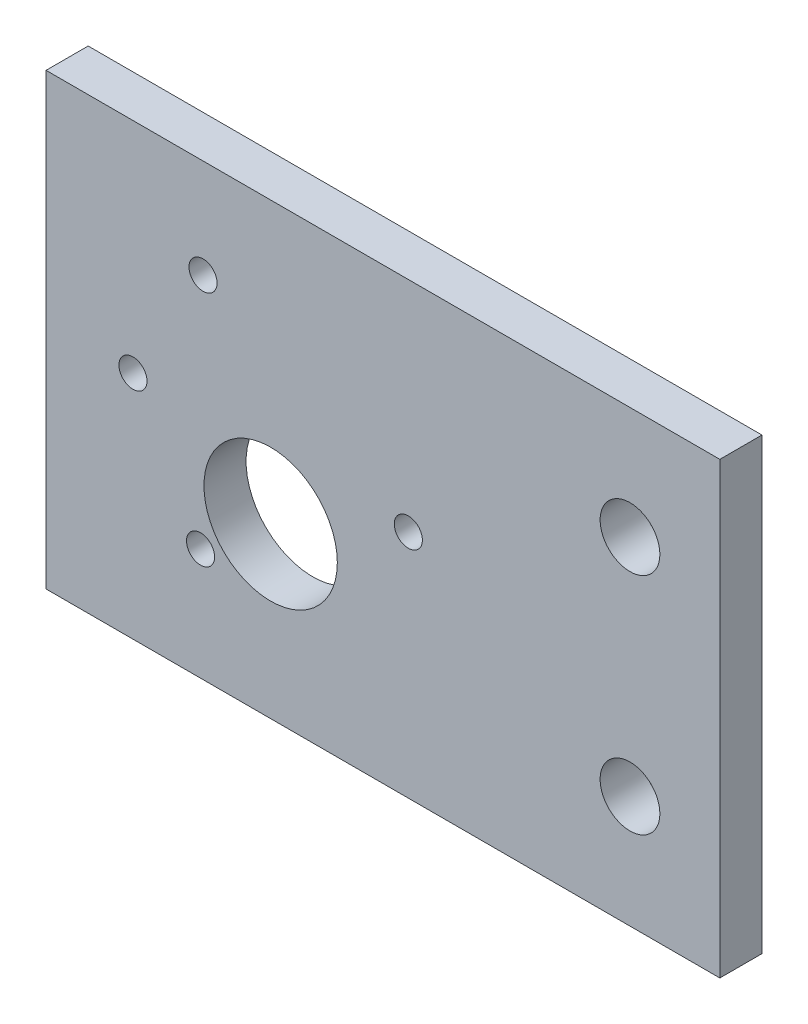
from build123d import *

# Parameters (mm, degrees)
SKETCH1_W                        = 76.2
SKETCH1_H                        = 50.8
BOSS_EXTRUDE1_DEPTH              = 4.7625
F_19_32_0_59375_DIAMETER_HOLE1_D = 15.08125
F_1_8_0_125_DIAMETER_HOLE1_D     = 3.175
H_0_266_DIAMETER_HOLE1_D         = 6.7564


with BuildPart() as part:
    # Sketch1 → Boss-Extrude1 (new body)
    with BuildSketch(Plane.XY):
        Rectangle(SKETCH1_W, SKETCH1_H)
    extrude(amount=BOSS_EXTRUDE1_DEPTH)

    # 19/32 (0.59375) Diameter Hole1 (through all)
    with Locations(Plane.XY.offset(4.7625)):
        with Locations((-12.7, -6.35)):
            Hole(F_19_32_0_59375_DIAMETER_HOLE1_D / 2)

    # 1/8 (0.125) Diameter Hole1 (through all)
    with Locations(Plane.XY.offset(4.7625)):
        with Locations((-20.3454, 14.22428539), (-28.2702, 0.6604), (-20.6248, -12.74216218), (2.8702, 0.6604)):
            Hole(F_1_8_0_125_DIAMETER_HOLE1_D / 2)

    # H (0.266) Diameter Hole1 (through all)
    with Locations(Plane.XY.offset(4.7625)):
        with Locations((27.94, 12.7), (27.94, -12.7)):
            Hole(H_0_266_DIAMETER_HOLE1_D / 2)


solid = part.part
